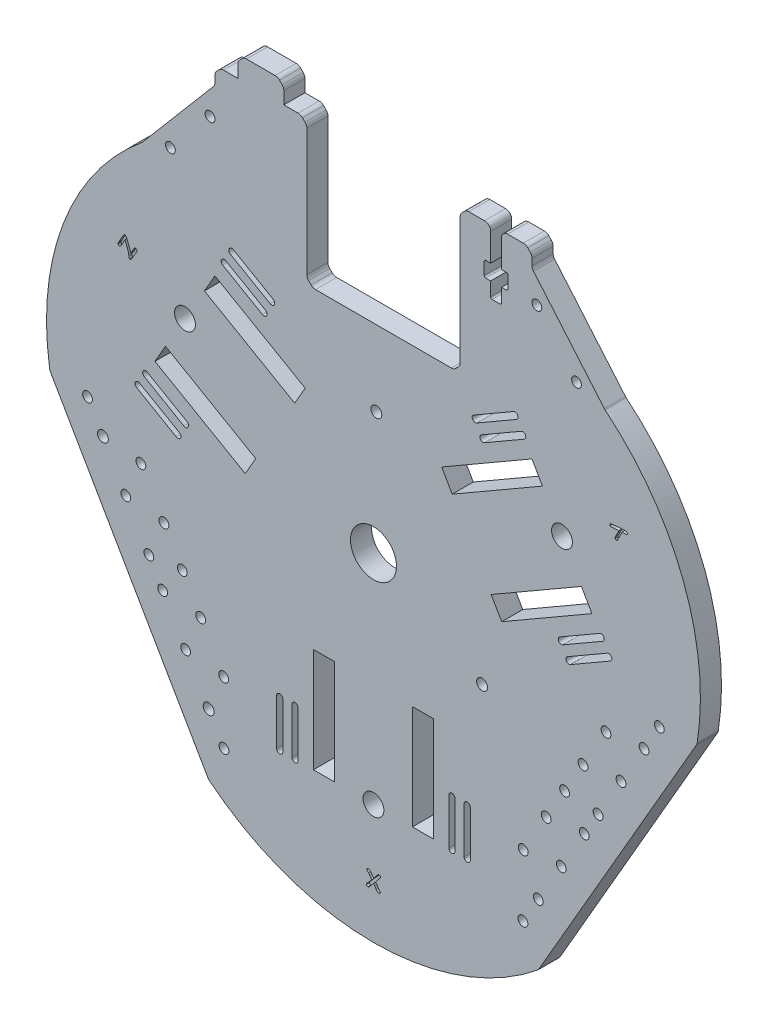
from build123d import *

# Parameters (mm, degrees)
SKETCH1_R           = 110
BOSS_EXTRUDE1_DEPTH = 6.88
SKETCH2_R           = 250
SKETCH2_R_2         = 110
CUT_EXTRUDE1_DEPTH  = 156.715556063
SKETCH4_R           = 3.4
CUT_EXTRUDE2_DEPTH  = 10
CIRPATTERN1_COUNT   = 3
BOSS_EXTRUDE2_DEPTH = 6.88
CHAMFER1_DEPTH      = 6.88
SKETCH7_W           = 50
SKETCH7_H           = 32
CUT_EXTRUDE5_DEPTH  = 155.808566837
SKETCH8_W           = 2.085
SKETCH8_H           = 5
SKETCH8_W_2         = 3.55
SKETCH8_H_2         = 11
CUT_EXTRUDE6_DEPTH  = 6.88
SKETCH9_W           = 15
SKETCH9_H           = 13.76
BOSS_EXTRUDE3_DEPTH = 6.88
CUT_EXTRUDE7_DEPTH  = 6.88
CIRPATTERN2_COUNT   = 3
SKETCH11_R          = 1.775
CUT_EXTRUDE8_DEPTH  = 10
CHAMFER2_SIZE       = 2
SKETCH13_R          = 7.5
CUT_EXTRUDE10_DEPTH = 10
SKETCH15_R          = 1.6
CUT_EXTRUDE11_DEPTH = 10
SKETCH17_R          = 1.6
CUT_EXTRUDE13_DEPTH = 160.856644423
FILLET1_R           = 2
FILLET2_R           = 0.5
CUT_EXTRUDE15_DEPTH = 1


with BuildPart() as part:
    # Sketch1 → Boss-Extrude1 (new body)
    with BuildSketch(Plane.XY):
        Circle(SKETCH1_R)
    extrude(amount=BOSS_EXTRUDE1_DEPTH)

    # Sketch2 → Cut-Extrude1 (cut, through all)
    # profile 1 of 4: a face of its own
    with BuildSketch(Plane.XY.offset(6.88)):
        Circle(SKETCH2_R)
        Circle(SKETCH2_R_2, mode=Mode.SUBTRACT)
    # profile 2 of 4: a face of its own
    with BuildSketch(Plane.XY.offset(6.88)):
        with BuildLine():
            ThreePointArc((95.262813375, 54.999967162), (6.87e-07, 110), (-95.262812689, 54.999968351))
            ThreePointArc((-95.262812689, 54.999968351), (-76.69805922, 77.267129759), (-51.72969758, 92))
            Line((-51.72969758, 92), (51.72969758, 92))
            ThreePointArc((51.72969758, 92), (76.698059743, 77.267129314), (95.262813375, 54.999967162))
        make_face()
    # profile 3 of 4: a face of its own
    with BuildSketch(Plane.XY.offset(6.88)):
        with BuildLine():
            Line((-53.809488358, -90.799232234), (-105.539185938, -1.200767766))
            ThreePointArc((-105.539185938, -1.200767766), (-105.264333432, 27.788866877), (-95.262812689, 54.999968351))
            ThreePointArc((-95.262812689, 54.999968351), (-95.262785273, -55.000015837), (2.9e-08, -110))
            ThreePointArc((2.9e-08, -110), (-28.566284835, -105.056026449), (-53.809488358, -90.799232234))
        make_face()
    # profile 4 of 4: a face of its own
    with BuildSketch(Plane.XY.offset(6.88)):
        with BuildLine():
            ThreePointArc((53.809488358, -90.799232234), (28.566284862, -105.056026439), (2.9e-08, -110))
            ThreePointArc((2.9e-08, -110), (77.781745941, -77.78174592), (110, 0))
            ThreePointArc((110, 0), (106.251845799, 28.470076648), (95.262813375, 54.999967162))
            ThreePointArc((95.262813375, 54.999967162), (105.264333555, 27.788866202), (105.539185938, -1.200767766))
            Line((105.539185938, -1.200767766), (53.809488358, -90.799232234))
        make_face()
    extrude(amount=-CUT_EXTRUDE1_DEPTH, mode=Mode.SUBTRACT)

    # Sketch4 → Cut-Extrude2 (cut)
    with BuildSketch(Plane(origin=(0, 0, 0), x_dir=(-1, 0, 0), z_dir=(0, 0, -1))):
        with Locations((61.487803669, 35.5)):
            Circle(SKETCH4_R)
        Polygon((41.83293994, 1.543222594), (38.39293994, 7.501477372), (67.837803669, 24.501477372), (71.277803669, 18.543222594), align=None)
        Polygon((25.692939941, 29.498522627), (22.252939941, 35.456777405), (51.697803669, 52.456777405), (55.137803669, 46.498522627), align=None)
    cut_extrude2 = extrude(amount=-CUT_EXTRUDE2_DEPTH, mode=Mode.SUBTRACT)

    # CirPattern1: Cut-Extrude2 ×3 about axis
    cirpattern1_axis = Axis((0, 0, 0), (0, 0, 1))
    for i in range(1, CIRPATTERN1_COUNT):
        add(cut_extrude2.rotate(cirpattern1_axis, i * 360 / CIRPATTERN1_COUNT), mode=Mode.SUBTRACT)

    # Sketch6 → Boss-Extrude2 (add)
    with BuildSketch(Plane.XY.offset(6.88)):
        Polygon((-21.72969758, 112), (-21.72969758, 97), (28.27030242, 97), (28.27030242, 112), (51.72969758, 112), (51.72969758, 92), (-51.72969758, 92), (-51.72969758, 112), align=None)
    extrude(amount=-BOSS_EXTRUDE2_DEPTH)

    # Chamfer1: read off the stored shape, not the designer's step
    # Chamfer1 outline → Chamfer1 (add)
    with BuildSketch(Plane.XY):
        with BuildLine():
            Line((-51.72969758, 106.285493371), (-75.437135438, 78.318024741))
            ThreePointArc((-75.437135438, 78.318024741), (-64.13777749, 86.119581166), (-51.72969758, 92))
            Line((-51.72969758, 92), (-51.72969758, 106.285493371))
        make_face()
        with BuildLine():
            Line((75.437135438, 78.318024741), (51.72969758, 106.285493371))
            Line((51.72969758, 106.285493371), (51.72969758, 92))
            ThreePointArc((51.72969758, 92), (64.13777749, 86.119581166), (75.437135438, 78.318024741))
        make_face()
    extrude(amount=CHAMFER1_DEPTH)

    # Sketch7 → Cut-Extrude5 (cut, through all)
    with BuildSketch(Plane.XY.offset(6.88)):
        with Locations((3.27030242, 81)):
            Rectangle(SKETCH7_W, SKETCH7_H)
    extrude(amount=-CUT_EXTRUDE5_DEPTH, mode=Mode.SUBTRACT)

    # Sketch8 → Cut-Extrude6 (cut)
    with BuildSketch(Plane.XY.offset(6.88)):
        with Locations((42.8175, 98.5)):
            Rectangle(SKETCH8_W, SKETCH8_H)
        with Locations((40, 93.5)):
            Rectangle(SKETCH8_W_2, SKETCH8_H)
        with Locations((40, 98.5)):
            Rectangle(SKETCH8_W_2, SKETCH8_H)
        with Locations((37.1825, 98.5)):
            Rectangle(SKETCH8_W, SKETCH8_H)
        with Locations((40, 106.5)):
            Rectangle(SKETCH8_W_2, SKETCH8_H_2)
    extrude(amount=-CUT_EXTRUDE6_DEPTH, mode=Mode.SUBTRACT)

    # Sketch9 → Boss-Extrude3 (add)
    with BuildSketch(Plane.XY.offset(6.88)):
        with Locations((-36.72969758, 112)):
            Rectangle(SKETCH9_W, SKETCH9_H)
    extrude(amount=-BOSS_EXTRUDE3_DEPTH)

    # Sketch10 → Cut-Extrude7 (cut)
    with BuildSketch(Plane.XY.offset(6.88)):
        with BuildLine():
            Line((24.58, -71), (24.58, -56))
            ThreePointArc((24.58, -56), (25.58, -55), (26.58, -56))
            Line((26.58, -56), (26.58, -71))
            ThreePointArc((26.58, -71), (25.58, -72), (24.58, -71))
        make_face()
        with BuildLine():
            Line((31.58, -71), (31.58, -56))
            ThreePointArc((31.58, -56), (30.58, -55), (29.58, -56))
            Line((29.58, -56), (29.58, -71))
            ThreePointArc((29.58, -71), (30.58, -72), (31.58, -71))
        make_face()
        with BuildLine():
            Line((-24.58, -71), (-24.58, -56))
            ThreePointArc((-24.58, -56), (-25.58, -55), (-26.58, -56))
            Line((-26.58, -56), (-26.58, -71))
            ThreePointArc((-26.58, -71), (-25.58, -72), (-24.58, -71))
        make_face()
        with BuildLine():
            Line((-31.58, -71), (-31.58, -56))
            ThreePointArc((-31.58, -56), (-30.58, -55), (-29.58, -56))
            Line((-29.58, -56), (-29.58, -71))
            ThreePointArc((-29.58, -71), (-30.58, -72), (-31.58, -71))
        make_face()
    cut_extrude7 = extrude(amount=-CUT_EXTRUDE7_DEPTH, mode=Mode.SUBTRACT)

    # CirPattern2: Cut-Extrude7 ×3 about axis
    cirpattern2_axis = Axis((0, 0, 0), (0, 0, 1))
    for i in range(1, CIRPATTERN2_COUNT):
        add(cut_extrude7.rotate(cirpattern2_axis, i * 360 / CIRPATTERN2_COUNT), mode=Mode.SUBTRACT)

    # Sketch11 → Cut-Extrude8 (cut)
    with BuildSketch(Plane(origin=(0, 0, 0), x_dir=(-1, 0, 0), z_dir=(0, 0, -1))):
        with Locations((-0.936533479, 40.377876431)):
            Circle(SKETCH11_R)
        with Locations((-35.436533479, -19.377876431)):
            Circle(SKETCH11_R)
        with Locations((88.26408311, -11.122123569)):
            Circle(SKETCH11_R)
        with Locations((53.76408311, -70.877876431)):
            Circle(SKETCH11_R)
    extrude(amount=-CUT_EXTRUDE8_DEPTH, mode=Mode.SUBTRACT)

    # Chamfer2
    chamfer2_edges = [part.edges().sort_by_distance(p)[0] for p in [
        (51.72969758, 112, 3.44),
        (-51.72969758, 112, 3.44),
        (-21.72969758, 112, 3.44),
        (28.27030242, 112, 3.44),
        (-21.72969758, 65, 3.44),
        (28.27030242, 65, 3.44),
        (-44.22969758, 118.88, 3.44),
        (-29.22969758, 118.88, 3.44),
    ]]
    chamfer(chamfer2_edges, length=CHAMFER2_SIZE)

    # Sketch13 → Cut-Extrude10 (cut)
    with BuildSketch(Plane(origin=(0, 0, 0), x_dir=(-1, 0, 0), z_dir=(0, 0, -1))):
        Circle(SKETCH13_R)
    extrude(amount=-CUT_EXTRUDE10_DEPTH, mode=Mode.SUBTRACT)

    # Sketch15 → Cut-Extrude11 (cut)
    with BuildSketch(Plane(origin=(0, 0, 0), x_dir=(-1, 0, 0), z_dir=(0, 0, -1))):
        with Locations((53.76408311, -70.877876431)):
            Circle(SKETCH15_R)
        with Locations(Location((48.853829073, -59.382685902, 0), (0, 0, 180))):
            Circle(SKETCH15_R)
        with Locations(Location((61.26408311, -57.887495374, 0), (0, 0, 180))):
            Circle(SKETCH15_R)
        with Locations(Location((56.353829073, -46.392304845, 0), (0, 0, 180))):
            Circle(SKETCH15_R)
        with Locations(Location((68.76408311, -44.897114317, 0), (0, 0, 180))):
            Circle(SKETCH15_R)
        with Locations((62.353829073, -36)):
            Circle(SKETCH15_R)
        with Locations((73.26408311, -37.102885683)):
            Circle(SKETCH15_R)
        with Locations((68.353829073, -25.607695155)):
            Circle(SKETCH15_R)
        with Locations((80.76408311, -24.112504626)):
            Circle(SKETCH15_R)
        with Locations((75.853829073, -12.617314098)):
            Circle(SKETCH15_R)
        with Locations((88.26408311, -11.122123569)):
            Circle(SKETCH15_R)
        with Locations(Location((-88.26408311, -11.122123569, 0), (0, 0, 180))):
            Circle(SKETCH15_R)
        with Locations(Location((-75.853829072, -12.617314098, 0), (0, 0, 180))):
            Circle(SKETCH15_R)
        with Locations(Location((-80.76408311, -24.112504626, 0), (0, 0, 180))):
            Circle(SKETCH15_R)
        with Locations(Location((-68.353829072, -25.607695155, 0), (0, 0, 180))):
            Circle(SKETCH15_R)
        with Locations(Location((-73.26408311, -37.102885683, 0), (0, 0, 180))):
            Circle(SKETCH15_R)
        with Locations((-62.353829072, -36)):
            Circle(SKETCH15_R)
        with Locations((-68.76408311, -44.897114317)):
            Circle(SKETCH15_R)
        with Locations((-56.353829072, -46.392304845)):
            Circle(SKETCH15_R)
        with Locations((-61.26408311, -57.887495374)):
            Circle(SKETCH15_R)
        with Locations((-48.853829072, -59.382685902)):
            Circle(SKETCH15_R)
        with Locations((-53.76408311, -70.877876431)):
            Circle(SKETCH15_R)
        with Locations((93.26408311, -2.461869532)):
            Circle(SKETCH15_R)
        with Locations(Location((48.76408311, -79.538130468, 0), (0, 0, 180))):
            Circle(SKETCH15_R)
        with Locations((-48.76408311, -79.538130468)):
            Circle(SKETCH15_R)
        with Locations(Location((-93.26408311, -2.461869532, 0), (0, 0, 180))):
            Circle(SKETCH15_R)
    extrude(amount=-CUT_EXTRUDE11_DEPTH, mode=Mode.SUBTRACT)

    # Sketch17 → Cut-Extrude13 (cut, through all)
    with BuildSketch(Plane(origin=(0, 0, 0), x_dir=(-1, 0, 0), z_dir=(0, 0, -1))):
        with Locations((-53.303155084, 96.696781814)):
            Circle(SKETCH17_R)
        with Locations((-66.235555158, 81.440536262)):
            Circle(SKETCH17_R)
        with Locations(Location((66.235555158, 81.440536262, 0), (0, 0, 180))):
            Circle(SKETCH17_R)
        with Locations(Location((53.303155084, 96.696781814, 0), (0, 0, 180))):
            Circle(SKETCH17_R)
    extrude(amount=-CUT_EXTRUDE13_DEPTH, mode=Mode.SUBTRACT)

    # Fillet1
    fillet1_edges = [part.edges().sort_by_distance(p)[0] for p in [
        (-53.809488358, -90.799232234, 3.44),
        (-51.72969758, 106.285493371, 3.44),
        (105.539185938, -1.200767766, 3.44),
        (-75.437135438, 78.318024741, 3.44),
        (75.437135438, 78.318024741, 3.44),
        (51.72969758, 106.285493371, 3.44),
        (-105.539185938, -1.200767766, 3.44),
        (53.809488358, -90.799232234, 3.44),
        (38.225, 112, 3.44),
        (41.775, 112, 3.44),
        (28.27030242, 110, 3.44),
        (28.27030242, 67, 3.44),
        (-19.72969758, 65, 3.44),
        (26.27030242, 65, 3.44),
        (-21.72969758, 110, 3.44),
        (-21.72969758, 67, 3.44),
        (30.27030242, 112, 3.44),
        (51.72969758, 110, 3.44),
        (49.72969758, 112, 3.44),
        (-49.72969758, 112, 3.44),
        (-51.72969758, 110, 3.44),
        (-31.22969758, 118.88, 3.44),
        (-42.22969758, 118.88, 3.44),
        (-44.22969758, 116.88, 3.44),
        (-29.22969758, 116.88, 3.44),
        (-23.72969758, 112, 3.44),
    ]]
    fillet(fillet1_edges, radius=FILLET1_R)

    # Fillet2
    fillet2_edges = [part.edges().sort_by_distance(p)[0] for p in [
        (43.86, 101, 3.44),
        (43.86, 96, 3.44),
        (41.775, 91, 3.44),
        (38.225, 91, 3.44),
        (36.14, 96, 3.44),
        (36.14, 101, 3.44),
    ]]
    fillet(fillet2_edges, radius=FILLET2_R)

    # Sketch21 → Cut-Extrude15 (cut)
    with BuildSketch(Plane.XY.offset(6.88)):
        with BuildLine():
            Line((-78.172380141, 46.871259788), (-78.815120608, 45.758438686))
            add(Edge.make_bspline(
                [(-78.815120608, 45.758438686), (-78.826222016, 45.738366163), (-78.849627909, 45.696045829), (-78.885175765, 45.628558897), (-78.923762732, 45.554030683), (-78.963796498, 45.471950296), (-79.006029658, 45.383005936), (-79.050123436, 45.286736948), (-79.096880353, 45.183510188), (-79.128272557, 45.111817033), (-79.144418942, 45.074942106)],
                knots=[0, 0, 0, 0, 0.090662034, 0.191149243, 0.301479501, 0.422369635, 0.55208769, 0.69065395, 0.840889791, 1, 1, 1, 1], degree=3))
            add(Edge.make_bspline(
                [(-79.144418942, 45.074942106), (-79.157646283, 45.135859664), (-79.184630859, 45.260135174), (-79.233014572, 45.449317861), (-79.287291739, 45.645517666), (-79.348853302, 45.848406891), (-79.417605845, 46.057963776), (-79.492594816, 46.274520133), (-79.574703295, 46.498137683), (-79.633811512, 46.648526992), (-79.663917512, 46.725125827)],
                knots=[0, 0, 0, 0, 0.107961987, 0.220248994, 0.338157253, 0.460533199, 0.587439473, 0.720130635, 0.857452185, 1, 1, 1, 1], degree=3))
            add(Edge.make_bspline(
                [(-79.663917512, 46.725125827), (-79.772657809, 46.990481579), (-79.990211088, 47.521370457), (-80.210533034, 48.051116312), (-80.320730813, 48.316077736)],
                knots=[0, 0, 0, 0, 0.499832946, 1, 1, 1, 1], degree=3))
            add(Edge.make_bspline(
                [(-80.320730813, 48.316077736), (-80.334829903, 48.351376371), (-80.361577662, 48.418342352), (-80.399249681, 48.513759474), (-80.435148144, 48.597568221), (-80.465198729, 48.671792612), (-80.491855257, 48.73512368), (-80.514442847, 48.787789352), (-80.532853003, 48.829854743), (-80.544398323, 48.854053167), (-80.549399788, 48.864535994)],
                knots=[0, 0, 0, 0, 0.191878469, 0.364017752, 0.517812638, 0.652086183, 0.768237333, 0.864662651, 0.941371473, 1, 1, 1, 1], degree=3))
            add(Edge.make_bspline(
                [(-80.549399788, 48.864535994), (-80.576874704, 48.915164438), (-80.628557089, 49.010400351), (-80.716883451, 49.135511803), (-80.80859067, 49.235800434), (-80.878705626, 49.282729091), (-80.911576162, 49.304729677)],
                knots=[0, 0, 0, 0, 0.299162416, 0.56274702, 0.795011788, 1, 1, 1, 1], degree=3))
            add(Edge.make_bspline(
                [(-80.911576162, 49.304729677), (-80.940203978, 49.319356388), (-80.995702436, 49.347712023), (-81.085842196, 49.366145626), (-81.176136195, 49.361237886), (-81.231908647, 49.340895771), (-81.260541846, 49.330452268)],
                knots=[0, 0, 0, 0, 0.264295607, 0.512368758, 0.749653428, 1, 1, 1, 1], degree=3))
            add(Edge.make_bspline(
                [(-81.260541846, 49.330452268), (-81.286361334, 49.317899798), (-81.338546415, 49.292529364), (-81.408291274, 49.236199345), (-81.471252548, 49.166220652), (-81.505428911, 49.111428241), (-81.523112493, 49.083077475)],
                knots=[0, 0, 0, 0, 0.234031378, 0.473012719, 0.727325507, 1, 1, 1, 1], degree=3))
            add(Edge.make_bspline(
                [(-81.523112493, 49.083077475), (-81.544735939, 49.045324041), (-81.59055928, 48.965318824), (-81.663702501, 48.838687871), (-81.743019335, 48.69799365), (-81.831739939, 48.544703032), (-81.925046204, 48.376772302), (-82.027868085, 48.196301048), (-82.136729358, 48.001700119), (-82.25145811, 47.79831817), (-82.36621402, 47.594951702), (-82.475136105, 47.400066388), (-82.57826239, 47.219637639), (-82.673162956, 47.052291345), (-82.76037368, 46.898143502), (-82.840124334, 46.757509053), (-82.913187638, 46.630832668), (-82.959020383, 46.550832798), (-82.980648268, 46.513081886)],
                knots=[0, 0, 0, 0, 0.044176665, 0.093617008, 0.148485422, 0.208170858, 0.273450538, 0.343546322, 0.419071457, 0.499859762, 0.580648066, 0.656173202, 0.72655044, 0.791664212, 0.851514578, 0.906382992, 0.955823335, 1, 1, 1, 1], degree=3))
            add(Edge.make_bspline(
                [(-82.980648268, 46.513081886), (-82.989562069, 46.497780502), (-83.009263251, 46.463961555), (-83.044452616, 46.40978287), (-83.084306585, 46.344982943), (-83.130708243, 46.274808588), (-83.177120656, 46.204835678), (-83.218665799, 46.140758423), (-83.252398429, 46.085667234), (-83.272333754, 46.051815985), (-83.281318728, 46.036559018)],
                knots=[0, 0, 0, 0, 0.094259128, 0.208330453, 0.343845134, 0.499228138, 0.656140107, 0.79086347, 0.905740872, 1, 1, 1, 1], degree=3))
            add(Edge.make_bspline(
                [(-83.281318728, 46.036559018), (-83.295181641, 46.009117095), (-83.322396589, 45.955244541), (-83.345760419, 45.868601789), (-83.350860398, 45.779648873), (-83.341185073, 45.721528809), (-83.336251012, 45.69188971)],
                knots=[0, 0, 0, 0, 0.257820791, 0.506140357, 0.748149716, 1, 1, 1, 1], degree=3))
            add(Edge.make_bspline(
                [(-83.336251012, 45.69188971), (-83.326574082, 45.658003376), (-83.307391013, 45.590828782), (-83.248026293, 45.501351571), (-83.16802596, 45.423724831), (-83.102363486, 45.384763263), (-83.06813006, 45.364450474)],
                knots=[0, 0, 0, 0, 0.240754513, 0.477259843, 0.727467066, 1, 1, 1, 1], degree=3))
            add(Edge.make_bspline(
                [(-83.06813006, 45.364450474), (-83.043630434, 45.352634852), (-82.99613918, 45.329730879), (-82.920850881, 45.311397876), (-82.846781166, 45.306170907), (-82.773180219, 45.315774028), (-82.700287512, 45.339050581), (-82.628337541, 45.376618743), (-82.557660553, 45.428011609), (-82.513974544, 45.469723041), (-82.49110572, 45.49155821)],
                knots=[0, 0, 0, 0, 0.127142861, 0.246459849, 0.3605166, 0.473262713, 0.592046012, 0.71721936, 0.851969522, 1, 1, 1, 1], degree=3))
            add(Edge.make_bspline(
                [(-82.49110572, 45.49155821), (-82.480572292, 45.503011224), (-82.4574251, 45.528179204), (-82.422801949, 45.572150501), (-82.38416178, 45.624369581), (-82.34254247, 45.685332707), (-82.297801365, 45.755216588), (-82.248958968, 45.833235382), (-82.195641282, 45.919398129), (-82.160746659, 45.980538586), (-82.142540123, 46.012439085)],
                knots=[0, 0, 0, 0, 0.074324925, 0.163328908, 0.267209489, 0.384702411, 0.515924197, 0.663666423, 0.824515393, 1, 1, 1, 1], degree=3))
            add(Edge.make_bspline(
                [(-82.142540123, 46.012439085), (-82.124385403, 46.044044993), (-82.086704011, 46.109645265), (-82.028674244, 46.212138565), (-81.967953914, 46.323293353), (-81.903631996, 46.442905705), (-81.834854618, 46.570643715), (-81.761465263, 46.706118103), (-81.685802437, 46.850268095), (-81.634112981, 46.948956602), (-81.6076277, 46.999523837)],
                knots=[0, 0, 0, 0, 0.097389304, 0.202138304, 0.314694358, 0.435802545, 0.56501468, 0.702330778, 0.847476573, 1, 1, 1, 1], degree=3))
            add(Edge.make_bspline(
                [(-81.6076277, 46.999523837), (-81.574374234, 47.062857918), (-81.5112259, 47.183129346), (-81.42187681, 47.354733829), (-81.340314857, 47.506748758), (-81.269763248, 47.641684925), (-81.208625729, 47.757892588), (-81.156137805, 47.855581432), (-81.112909433, 47.934449402), (-81.087926891, 47.981495108), (-81.077090178, 48.001902191)],
                knots=[0, 0, 0, 0, 0.189219172, 0.359327227, 0.511763811, 0.645541699, 0.762100804, 0.859098755, 0.938881067, 1, 1, 1, 1], degree=3))
            Line((-81.077090178, 48.001902191), (-81.069468724, 47.982914408))
            add(Edge.make_bspline(
                [(-81.069468724, 47.982914408), (-80.948970762, 47.69533609), (-80.708328689, 47.121023949), (-80.46890981, 46.546200809), (-80.349376397, 46.259211861)],
                knots=[0, 0, 0, 0, 0.500735221, 1, 1, 1, 1], degree=3))
            add(Edge.make_bspline(
                [(-80.349376397, 46.259211861), (-80.313286455, 46.16860161), (-80.243282042, 45.992843019), (-80.147986344, 45.73486037), (-80.063655525, 45.491461382), (-79.992171159, 45.261903707), (-79.93320792, 45.046647071), (-79.886582998, 44.845601993), (-79.849682188, 44.659091745), (-79.8351716, 44.538484011), (-79.828230113, 44.480788415)],
                knots=[0, 0, 0, 0, 0.157418586, 0.305348111, 0.443857844, 0.573145767, 0.693349039, 0.803990476, 0.906234152, 1, 1, 1, 1], degree=3))
            add(Edge.make_bspline(
                [(-79.828230113, 44.480788415), (-79.825475521, 44.432119697), (-79.820209363, 44.339076099), (-79.816814739, 44.205222451), (-79.811118672, 44.083950206), (-79.809577577, 44.007007663), (-79.80885152, 43.970757657)],
                knots=[0, 0, 0, 0, 0.286488216, 0.547700768, 0.786907876, 1, 1, 1, 1], degree=3))
            add(Edge.make_bspline(
                [(-79.80885152, 43.970757657), (-79.805341964, 43.930325512), (-79.798620099, 43.852885689), (-79.781153758, 43.742936907), (-79.757140162, 43.644993518), (-79.728441468, 43.55845707), (-79.692463371, 43.484071241), (-79.651069087, 43.421408578), (-79.604249938, 43.369227012), (-79.566790851, 43.344641017), (-79.548439159, 43.33259602)],
                knots=[0, 0, 0, 0, 0.170363389, 0.326297563, 0.46684298, 0.59338275, 0.708404569, 0.812561082, 0.908171246, 1, 1, 1, 1], degree=3))
            add(Edge.make_bspline(
                [(-79.548439159, 43.33259602), (-79.533814548, 43.32511674), (-79.505001299, 43.310381145), (-79.458966751, 43.296301387), (-79.411757032, 43.292125159), (-79.363887567, 43.294702083), (-79.315198589, 43.306552994), (-79.265415019, 43.325174373), (-79.214398539, 43.352333434), (-79.164105646, 43.389469824), (-79.110465702, 43.43188493), (-79.058046658, 43.484257737), (-79.003490023, 43.543746979), (-78.948131813, 43.611424811), (-78.892146697, 43.687619221), (-78.834247559, 43.771086751), (-78.775808533, 43.862848834), (-78.737999859, 43.927579364), (-78.718468859, 43.961017513)],
                knots=[0, 0, 0, 0, 0.043058526, 0.084833436, 0.125336768, 0.166838189, 0.210069923, 0.25625468, 0.306057815, 0.361127305, 0.420073283, 0.485344791, 0.555249622, 0.631872056, 0.714621559, 0.803303753, 0.898391714, 1, 1, 1, 1], degree=3))
            add(Edge.make_bspline(
                [(-78.718468859, 43.961017513), (-78.707506503, 43.979968076), (-78.684283896, 44.020112866), (-78.647515572, 44.083702623), (-78.606765769, 44.153651593), (-78.562979471, 44.230825264), (-78.51438442, 44.314202802), (-78.461927294, 44.404328908), (-78.406430061, 44.501679131), (-78.347278209, 44.60258335), (-78.289244073, 44.704455004), (-78.23270259, 44.800880548), (-78.181202163, 44.89155899), (-78.132518213, 44.974563745), (-78.088785799, 45.051768522), (-78.04802335, 45.121710191), (-78.011257895, 45.185301605), (-77.98803495, 45.225446199), (-77.977072435, 45.24439667)],
                knots=[0, 0, 0, 0, 0.044313304, 0.093873109, 0.148679419, 0.208168984, 0.273468318, 0.34401417, 0.419242915, 0.500281805, 0.580756981, 0.65654935, 0.726531682, 0.791831016, 0.851320581, 0.906126891, 0.955686696, 1, 1, 1, 1], degree=3))
            add(Edge.make_bspline(
                [(-77.977072435, 45.24439667), (-77.956008531, 45.280270544), (-77.909313199, 45.359797228), (-77.825813976, 45.486707005), (-77.727594604, 45.63688715), (-77.615097658, 45.799841722), (-77.502086904, 45.962630433), (-77.404626227, 46.114002951), (-77.321135287, 46.241600909), (-77.27418244, 46.321477119), (-77.253101398, 46.3573402)],
                knots=[0, 0, 0, 0, 0.093963263, 0.208301636, 0.343095276, 0.499347584, 0.655599892, 0.790719898, 0.906036737, 1, 1, 1, 1], degree=3))
            add(Edge.make_bspline(
                [(-77.253101398, 46.3573402), (-77.228822875, 46.402356995), (-77.183202636, 46.486945207), (-77.13708459, 46.615546654), (-77.115887567, 46.735486509), (-77.119667469, 46.847329667), (-77.150122529, 46.950160432), (-77.206826775, 47.042749247), (-77.288027101, 47.125592174), (-77.355683285, 47.168325323), (-77.39128058, 47.190809366)],
                knots=[0, 0, 0, 0, 0.158789931, 0.298372122, 0.422590565, 0.535204912, 0.643046542, 0.751970414, 0.869499254, 1, 1, 1, 1], degree=3))
            add(Edge.make_bspline(
                [(-77.39128058, 47.190809366), (-77.426587535, 47.209372463), (-77.494386534, 47.24501868), (-77.602129487, 47.274030495), (-77.708170687, 47.283422246), (-77.775890493, 47.270027109), (-77.809602905, 47.263358714)],
                knots=[0, 0, 0, 0, 0.274119847, 0.526384998, 0.764224009, 1, 1, 1, 1], degree=3))
            add(Edge.make_bspline(
                [(-77.809602905, 47.263358714), (-77.83848574, 47.254536128), (-77.895160017, 47.237224334), (-77.970215374, 47.190322891), (-78.036142342, 47.130611809), (-78.068011179, 47.080424732), (-78.084428347, 47.05457096)],
                knots=[0, 0, 0, 0, 0.254442313, 0.499270032, 0.742049963, 1, 1, 1, 1], degree=3))
            add(Edge.make_bspline(
                [(-78.084428347, 47.05457096), (-78.091015366, 47.0420093), (-78.106804596, 47.011898721), (-78.127816885, 46.962543787), (-78.150301454, 46.913863858), (-78.165855505, 46.883850032), (-78.172380141, 46.871259788)],
                knots=[0, 0, 0, 0, 0.20916486, 0.501372806, 0.79083514, 1, 1, 1, 1], degree=3))
        make_face()
        with BuildLine():
            Line((79.061358178, 44.404303313), (78.848099773, 43.990498692))
            add(Edge.make_bspline(
                [(78.848099773, 43.990498692), (78.834173047, 43.948527591), (78.807880693, 43.869290079), (78.795203079, 43.749407344), (78.809435492, 43.637336816), (78.840959403, 43.57215018), (78.856566458, 43.539877174)],
                knots=[0, 0, 0, 0, 0.284067558, 0.53629296, 0.770425029, 1, 1, 1, 1], degree=3))
            add(Edge.make_bspline(
                [(78.856566458, 43.539877174), (78.872745706, 43.514903227), (78.904691031, 43.465593096), (78.966801334, 43.403431083), (79.039618852, 43.353780083), (79.09417266, 43.332200331), (79.122049845, 43.321173003)],
                knots=[0, 0, 0, 0, 0.253463268, 0.500453809, 0.74473017, 1, 1, 1, 1], degree=3))
            add(Edge.make_bspline(
                [(79.122049845, 43.321173003), (79.152342971, 43.312562697), (79.211321021, 43.29579919), (79.3027965, 43.294026112), (79.391267268, 43.312834132), (79.444996712, 43.339461609), (79.472314514, 43.352999887)],
                knots=[0, 0, 0, 0, 0.259641861, 0.505499834, 0.748579988, 1, 1, 1, 1], degree=3))
            add(Edge.make_bspline(
                [(79.472314514, 43.352999887), (79.489321244, 43.363558172), (79.523133042, 43.384549543), (79.567472197, 43.425793571), (79.607135831, 43.472768086), (79.628639919, 43.508378322), (79.639507894, 43.52637542)],
                knots=[0, 0, 0, 0, 0.245834451, 0.48875383, 0.741620716, 1, 1, 1, 1], degree=3))
            add(Edge.make_bspline(
                [(79.639507894, 43.52637542), (79.687465795, 43.619445116), (79.780196254, 43.79940286), (79.915439262, 44.06028389), (80.040717139, 44.303421529), (80.155012311, 44.52963134), (80.262175777, 44.736645838), (80.357947006, 44.926943461), (80.444554406, 45.099280929), (80.498610527, 45.208434797), (80.524134639, 45.259974854)],
                knots=[0, 0, 0, 0, 0.161382873, 0.312046767, 0.452944208, 0.582975186, 0.702702395, 0.812249627, 0.911348401, 1, 1, 1, 1], degree=3))
            add(Edge.make_bspline(
                [(80.524134639, 45.259974854), (80.556240395, 45.323379842), (80.618437014, 45.446210648), (80.707737892, 45.624480279), (80.790446479, 45.790887571), (80.867289467, 45.944778971), (80.936462796, 46.087541576), (80.999194777, 46.218273224), (81.054893997, 46.337349053), (81.090019459, 46.412687215), (81.106602747, 46.448255558)],
                knots=[0, 0, 0, 0, 0.161103565, 0.312096598, 0.451970918, 0.582344716, 0.702008215, 0.811571636, 0.911039976, 1, 1, 1, 1], degree=3))
            add(Edge.make_bspline(
                [(81.106602747, 46.448255558), (81.162073853, 46.44788784), (81.269823631, 46.447173566), (81.426385232, 46.447719615), (81.57353446, 46.448499782), (81.711137305, 46.450749045), (81.839076602, 46.451769314), (81.957302596, 46.455111335), (82.065812462, 46.459339682), (82.16513142, 46.462645508), (82.254438026, 46.467684385), (82.334337307, 46.473297178), (82.404588942, 46.479375291), (82.46517947, 46.486831355), (82.516394636, 46.493059527), (82.557700707, 46.501556484), (82.589914042, 46.510233336), (82.607238582, 46.518125881), (82.614615249, 46.521486471)],
                knots=[0, 0, 0, 0, 0.109925929, 0.21352548, 0.310250042, 0.40152514, 0.486240886, 0.563782035, 0.635887526, 0.70143503, 0.760699456, 0.813128169, 0.860161851, 0.90040044, 0.934118865, 0.962324687, 0.983958117, 1, 1, 1, 1], degree=3))
            add(Edge.make_bspline(
                [(82.614615249, 46.521486471), (82.640403554, 46.538412729), (82.69129128, 46.571813093), (82.750791104, 46.641385027), (82.795136544, 46.722825464), (82.809810568, 46.783257756), (82.817405069, 46.814534324)],
                knots=[0, 0, 0, 0, 0.250599777, 0.494505294, 0.738382592, 1, 1, 1, 1], degree=3))
            add(Edge.make_bspline(
                [(82.817405069, 46.814534324), (82.821229938, 46.843897559), (82.828781131, 46.901867493), (82.82043608, 46.988976239), (82.798562424, 47.073854572), (82.771842432, 47.125870361), (82.758237533, 47.152355008)],
                knots=[0, 0, 0, 0, 0.253219206, 0.4999143, 0.745373594, 1, 1, 1, 1], degree=3))
            add(Edge.make_bspline(
                [(82.758237533, 47.152355008), (82.746803812, 47.169938766), (82.72391621, 47.205137286), (82.682253787, 47.252698528), (82.632357463, 47.293143303), (82.575983021, 47.326963774), (82.51307983, 47.354927673), (82.444232797, 47.378011104), (82.367795589, 47.39272539), (82.314586997, 47.398493087), (82.286968756, 47.401486845)],
                knots=[0, 0, 0, 0, 0.113198087, 0.226595759, 0.339793845, 0.458694635, 0.580612705, 0.710968431, 0.849976419, 1, 1, 1, 1], degree=3))
            add(Edge.make_bspline(
                [(82.286968756, 47.401486845), (82.282781462, 47.401720284), (82.271981269, 47.402322387), (82.25195391, 47.401489661), (82.224322136, 47.401378002), (82.188913458, 47.400801667), (82.145589947, 47.40089721), (82.094552398, 47.398052984), (82.035537386, 47.398734757), (81.968814243, 47.396025305), (81.894309576, 47.394717144), (81.811801871, 47.391357067), (81.721628864, 47.389412682), (81.623279984, 47.386148071), (81.517275602, 47.384088723), (81.403397912, 47.380666793), (81.28194002, 47.375928763), (81.198390193, 47.373918144), (81.155244034, 47.372879835)],
                knots=[0, 0, 0, 0, 0.011107749, 0.028649968, 0.053060272, 0.084338817, 0.122485677, 0.167838208, 0.219721798, 0.278806377, 0.344757735, 0.4171714, 0.497605076, 0.583750708, 0.677918343, 0.778546574, 0.885638723, 1, 1, 1, 1], degree=3))
            add(Edge.make_bspline(
                [(81.155244034, 47.372879835), (81.101764822, 47.371220893), (80.990653466, 47.367774185), (80.817688905, 47.35727421), (80.631633636, 47.34661584), (80.432596, 47.329675569), (80.220401429, 47.312603131), (79.995214699, 47.290055294), (79.756897839, 47.266471973), (79.593724835, 47.247826238), (79.510046021, 47.238264283)],
                knots=[0, 0, 0, 0, 0.097208708, 0.201966164, 0.314820975, 0.435796689, 0.564885979, 0.701603211, 0.846975366, 1, 1, 1, 1], degree=3))
            add(Edge.make_bspline(
                [(79.510046021, 47.238264283), (79.411600003, 47.227419944), (79.22372881, 47.206724959), (78.955389524, 47.17776177), (78.713701007, 47.15160895), (78.498589625, 47.130264645), (78.310302281, 47.110020071), (78.14884976, 47.094961085), (78.014031322, 47.082881275), (77.933044729, 47.076162069), (77.896925873, 47.073165399)],
                knots=[0, 0, 0, 0, 0.183229473, 0.349669191, 0.499319563, 0.632966993, 0.749583375, 0.849658119, 0.932949684, 1, 1, 1, 1], degree=3))
            add(Edge.make_bspline(
                [(77.896925873, 47.073165399), (77.862779249, 47.070786464), (77.798049882, 47.066276883), (77.706377657, 47.056104345), (77.624921988, 47.047946583), (77.554135853, 47.036392948), (77.493026993, 47.026966916), (77.442898722, 47.01408198), (77.402590838, 47.002273972), (77.380613909, 46.991439689), (77.371043221, 46.986721489)],
                knots=[0, 0, 0, 0, 0.19177336, 0.363531346, 0.516817976, 0.650299504, 0.765426683, 0.862924452, 0.940305246, 1, 1, 1, 1], degree=3))
            add(Edge.make_bspline(
                [(77.371043221, 46.986721489), (77.344767765, 46.969981607), (77.293501699, 46.93732041), (77.23425005, 46.868543287), (77.18957746, 46.78977029), (77.174915676, 46.73110531), (77.167383491, 46.700967403)],
                knots=[0, 0, 0, 0, 0.256847868, 0.5011361, 0.743719111, 1, 1, 1, 1], degree=3))
            add(Edge.make_bspline(
                [(77.167383491, 46.700967403), (77.163303302, 46.672479993), (77.155324614, 46.616773703), (77.158780196, 46.532351029), (77.181250932, 46.451520171), (77.20623481, 46.401658262), (77.218834977, 46.376511309)],
                knots=[0, 0, 0, 0, 0.256863085, 0.502288176, 0.748988037, 1, 1, 1, 1], degree=3))
            add(Edge.make_bspline(
                [(77.218834977, 46.376511309), (77.231418859, 46.356602245), (77.255774199, 46.318069459), (77.300531452, 46.267846371), (77.35082684, 46.227435331), (77.406175446, 46.195661906), (77.467290339, 46.174936292), (77.533294829, 46.162354261), (77.604659736, 46.158762228), (77.653482506, 46.163831873), (77.678684246, 46.166448764)],
                knots=[0, 0, 0, 0, 0.130587857, 0.252744872, 0.371396785, 0.487401855, 0.605096937, 0.72782624, 0.859507105, 1, 1, 1, 1], degree=3))
            add(Edge.make_bspline(
                [(77.678684246, 46.166448764), (77.718471664, 46.170774507), (77.795485036, 46.179147509), (77.9071439, 46.192582853), (78.011111666, 46.204894306), (78.107243595, 46.215901793), (78.195556712, 46.225421769), (78.276261029, 46.234241145), (78.34928045, 46.241870571), (78.395331709, 46.247166971), (78.416930711, 46.249651093)],
                knots=[0, 0, 0, 0, 0.16161036, 0.312816454, 0.454135353, 0.584375449, 0.703539251, 0.812816392, 0.912206979, 1, 1, 1, 1], degree=3))
            add(Edge.make_bspline(
                [(78.416930711, 46.249651093), (78.506774026, 46.257432184), (78.680579061, 46.272484974), (78.932441874, 46.292932426), (79.166776154, 46.312308322), (79.384071479, 46.32995687), (79.584146343, 46.34443542), (79.76677367, 46.356758679), (79.931814934, 46.36909097), (80.036320542, 46.375075869), (80.085844443, 46.377912038)],
                knots=[0, 0, 0, 0, 0.161623137, 0.31266561, 0.452882125, 0.583040208, 0.703390557, 0.812397564, 0.91109755, 1, 1, 1, 1], degree=3))
            add(Edge.make_bspline(
                [(80.085844443, 46.377912038), (80.071721129, 46.343322765), (80.042576486, 46.2719449), (79.995820736, 46.161888694), (79.941702129, 46.046628337), (79.883280785, 45.925002349), (79.819191621, 45.797717327), (79.750259856, 45.664070272), (79.675542834, 45.524535479), (79.623167558, 45.429809007), (79.596434445, 45.381459218)],
                knots=[0, 0, 0, 0, 0.100896508, 0.208208407, 0.322865805, 0.444716745, 0.572583786, 0.707694259, 0.850802837, 1, 1, 1, 1], degree=3))
            add(Edge.make_bspline(
                [(79.596434445, 45.381459218), (79.57574236, 45.343441775), (79.535676532, 45.269829071), (79.47638987, 45.163807713), (79.422484912, 45.063889898), (79.37117045, 44.971728376), (79.325461135, 44.885239851), (79.281223817, 44.807310608), (79.242909375, 44.735379144), (79.206556444, 44.67154958), (79.176256897, 44.61346251), (79.148104808, 44.563055938), (79.124850706, 44.519212411), (79.104151608, 44.48302355), (79.088034709, 44.453381753), (79.075089389, 44.431157467), (79.067933419, 44.414848508), (79.063111103, 44.407114607), (79.061358178, 44.404303313)],
                knots=[0, 0, 0, 0, 0.11655208, 0.225678347, 0.32708674, 0.422257678, 0.509713258, 0.590481468, 0.663531602, 0.729155773, 0.788253935, 0.839922688, 0.884614671, 0.921881182, 0.95216926, 0.975479676, 0.991086794, 1, 1, 1, 1], degree=3))
        make_face()
        with BuildLine():
            ThreePointArc((1.382038706, -93.534963819), (1.040808539, -93.053710555), (0.699431746, -92.57256129))
            add(Edge.make_bspline(
                [(0.699431746, -92.57256129), (0.744053457, -92.516054983), (0.830336949, -92.406790651), (0.954496789, -92.247874171), (1.070545054, -92.100840637), (1.173640189, -91.961408695), (1.271572332, -91.8355498), (1.356773232, -91.717497877), (1.433636723, -91.611130868), (1.481075102, -91.543357639), (1.503428962, -91.511421614)],
                knots=[0, 0, 0, 0, 0.162217039, 0.313673599, 0.454370866, 0.584199229, 0.704329881, 0.813620237, 0.912174334, 1, 1, 1, 1], degree=3))
            add(Edge.make_bspline(
                [(1.503428962, -91.511421614), (1.524432197, -91.482901324), (1.567815176, -91.423991581), (1.636204998, -91.333011314), (1.710177186, -91.236676576), (1.792193377, -91.136198775), (1.879753408, -91.030384189), (1.972439461, -90.91829036), (2.07213839, -90.802032316), (2.141239509, -90.72320196), (2.176625594, -90.682833617)],
                knots=[0, 0, 0, 0, 0.099493625, 0.20550786, 0.319717969, 0.440643391, 0.569809904, 0.705531708, 0.84920534, 1, 1, 1, 1], degree=3))
            add(Edge.make_bspline(
                [(2.176625594, -90.682833617), (2.195333819, -90.660214051), (2.231607224, -90.61635694), (2.268810389, -90.542317238), (2.294732104, -90.467133848), (2.297035618, -90.415612326), (2.298184844, -90.389908192)],
                knots=[0, 0, 0, 0, 0.270791682, 0.525038401, 0.763041221, 1, 1, 1, 1], degree=3))
            add(Edge.make_bspline(
                [(2.298184844, -90.389908192), (2.296697069, -90.360161993), (2.293759821, -90.301435354), (2.264185348, -90.217726464), (2.219758683, -90.139651093), (2.157061921, -90.071318697), (2.083259901, -90.013612708), (2.001308773, -89.970419744), (1.912399231, -89.944896003), (1.85120008, -89.941534389), (1.820039609, -89.939822772)],
                knots=[0, 0, 0, 0, 0.122373858, 0.241597432, 0.36238454, 0.491245057, 0.621634625, 0.747563281, 0.871468035, 1, 1, 1, 1], degree=3))
            add(Edge.make_bspline(
                [(1.820039609, -89.939822772), (1.797909945, -89.942730208), (1.747446955, -89.949360128), (1.669581612, -89.99130882), (1.580123033, -90.054076775), (1.477491991, -90.141000606), (1.363178841, -90.252833763), (1.236487788, -90.388856117), (1.096502545, -90.549135383), (1.001341246, -90.665902036), (0.95082259, -90.727890412)],
                knots=[0, 0, 0, 0, 0.055766944, 0.127167171, 0.218852282, 0.331346868, 0.464739459, 0.62107456, 0.798838349, 1, 1, 1, 1], degree=3))
            add(Edge.make_bspline(
                [(0.95082259, -90.727890412), (0.814338358, -90.910005886), (0.541268061, -91.27437271), (0.267186284, -91.637979295), (0.130094291, -91.819850384)],
                knots=[0, 0, 0, 0, 0.499813544, 1, 1, 1, 1], degree=3))
            add(Edge.make_bspline(
                [(0.130094291, -91.819850384), (0.03434181, -91.697138141), (-0.157535075, -91.451237013), (-0.358293823, -91.212531937), (-0.458867767, -91.092948053)],
                knots=[0, 0, 0, 0, 0.499030827, 1, 1, 1, 1], degree=3))
            add(Edge.make_bspline(
                [(-0.458867767, -91.092948053), (-0.500127831, -91.038056479), (-0.577400509, -90.935254435), (-0.68624979, -90.792233652), (-0.777579534, -90.668948095), (-0.854896407, -90.561477437), (-0.928742555, -90.464029989), (-1.009565349, -90.371900221), (-1.097534373, -90.278085575), (-1.161981578, -90.218688232), (-1.195053027, -90.188208149)],
                knots=[0, 0, 0, 0, 0.176280255, 0.330141211, 0.461386363, 0.570119861, 0.670035566, 0.775085779, 0.884583994, 1, 1, 1, 1], degree=3))
            add(Edge.make_bspline(
                [(-1.195053027, -90.188208149), (-1.218438453, -90.168607514), (-1.263144254, -90.131137079), (-1.329077348, -90.079293094), (-1.393112167, -90.037510994), (-1.451959472, -90.000523418), (-1.50915903, -89.974571373), (-1.561649642, -89.954098574), (-1.611180957, -89.941421701), (-1.643284185, -89.939808561), (-1.658545784, -89.939041688)],
                knots=[0, 0, 0, 0, 0.170917328, 0.326741782, 0.46927592, 0.599046029, 0.715433952, 0.820334949, 0.914588774, 1, 1, 1, 1], degree=3))
            add(Edge.make_bspline(
                [(-1.658545784, -89.939041688), (-1.690586979, -89.940339981), (-1.753071992, -89.942871842), (-1.841664894, -89.971535411), (-1.922742416, -90.015022669), (-1.991364053, -90.077099109), (-2.048419148, -90.148318453), (-2.090921596, -90.22550529), (-2.117721263, -90.30753307), (-2.120421831, -90.36403774), (-2.121781257, -90.392481351)],
                knots=[0, 0, 0, 0, 0.133364037, 0.260079368, 0.384988892, 0.515081457, 0.643500018, 0.764635409, 0.881520965, 1, 1, 1, 1], degree=3))
            add(Edge.make_bspline(
                [(-2.121781257, -90.392481351), (-2.119403447, -90.425387052), (-2.114641682, -90.491283477), (-2.078233516, -90.585874864), (-2.018569647, -90.672897231), (-1.933633499, -90.74906795), (-1.83724679, -90.831443711), (-1.739342625, -90.934775521), (-1.635281054, -91.05448491), (-1.567380764, -91.142564785), (-1.531672294, -91.188885611)],
                knots=[0, 0, 0, 0, 0.097176416, 0.194603921, 0.29572299, 0.406526051, 0.530761395, 0.671034221, 0.826998315, 1, 1, 1, 1], degree=3))
            add(Edge.make_bspline(
                [(-1.531672294, -91.188885611), (-1.505223685, -91.223730162), (-1.455460757, -91.289290012), (-1.3857257, -91.38159399), (-1.325052568, -91.460400333), (-1.276247504, -91.527947037), (-1.233900784, -91.58004665), (-1.202936251, -91.620933654), (-1.181519776, -91.648692631), (-1.170238794, -91.662551621), (-1.166334686, -91.667347923)],
                knots=[0, 0, 0, 0, 0.217994216, 0.410155048, 0.576482498, 0.71360182, 0.825302972, 0.910952693, 0.969182621, 1, 1, 1, 1], degree=3))
            add(Edge.make_bspline(
                [(-1.166334686, -91.667347923), (-1.048819904, -91.80680785), (-0.815946371, -92.083169046), (-0.593979288, -92.368363014), (-0.484023275, -92.509639781)],
                knots=[0, 0, 0, 0, 0.504629191, 1, 1, 1, 1], degree=3))
            add(Edge.make_bspline(
                [(-0.484023275, -92.509639781), (-0.542264399, -92.575261427), (-0.655777562, -92.703159381), (-0.821975336, -92.888830266), (-0.978494581, -93.064336664), (-1.126423136, -93.228705865), (-1.265148757, -93.382357265), (-1.395785128, -93.524405064), (-1.516121891, -93.656453621), (-1.593806729, -93.740699673), (-1.631030323, -93.78106715)],
                knots=[0, 0, 0, 0, 0.153714558, 0.299592871, 0.436565426, 0.565702889, 0.687006567, 0.799234035, 0.903800652, 1, 1, 1, 1], degree=3))
            add(Edge.make_bspline(
                [(-1.631030323, -93.78106715), (-1.662702758, -93.814943992), (-1.723965409, -93.880470535), (-1.812933774, -93.975658067), (-1.896718323, -94.063291874), (-1.972991802, -94.145981906), (-2.044022329, -94.221177525), (-2.108916677, -94.290010888), (-2.168163731, -94.351723136), (-2.205027087, -94.391202757), (-2.222449855, -94.409862051)],
                knots=[0, 0, 0, 0, 0.161173239, 0.311750572, 0.452803158, 0.582513433, 0.702696821, 0.812285402, 0.91128025, 1, 1, 1, 1], degree=3))
            add(Edge.make_bspline(
                [(-2.222449855, -94.409862051), (-2.239790509, -94.431480629), (-2.273461291, -94.473457963), (-2.309589915, -94.544472541), (-2.331718425, -94.619025916), (-2.334427381, -94.670171444), (-2.335785456, -94.695812119)],
                knots=[0, 0, 0, 0, 0.263952177, 0.512522547, 0.755614004, 1, 1, 1, 1], degree=3))
            add(Edge.make_bspline(
                [(-2.335785456, -94.695812119), (-2.334131316, -94.725430761), (-2.330832883, -94.784491742), (-2.297877063, -94.868858048), (-2.244790484, -94.94560954), (-2.173758619, -95.013312663), (-2.090613595, -95.071031249), (-1.997031187, -95.112004085), (-1.896859515, -95.138495692), (-1.827212065, -95.141065227), (-1.791737878, -95.142373993)],
                knots=[0, 0, 0, 0, 0.113792241, 0.226907141, 0.343764593, 0.471312438, 0.603284189, 0.731983622, 0.863488711, 1, 1, 1, 1], degree=3))
            add(Edge.make_bspline(
                [(-1.791737878, -95.142373993), (-1.75644975, -95.140831502), (-1.687412915, -95.137813811), (-1.587013573, -95.111211099), (-1.493174948, -95.067681289), (-1.437736569, -95.026267025), (-1.409760141, -95.005367728)],
                knots=[0, 0, 0, 0, 0.25536248, 0.499584947, 0.747470514, 1, 1, 1, 1], degree=3))
            add(Edge.make_bspline(
                [(-1.409760141, -95.005367728), (-1.379648693, -94.971329266), (-1.321176595, -94.905231474), (-1.237151628, -94.809071218), (-1.15930173, -94.719126419), (-1.086718915, -94.636187761), (-1.020210723, -94.559393556), (-0.960996571, -94.48773649), (-0.906994311, -94.423507098), (-0.873123678, -94.382617603), (-0.85716074, -94.363346734)],
                knots=[0, 0, 0, 0, 0.16093871, 0.3125198, 0.452223114, 0.582202387, 0.702829541, 0.811970064, 0.911383103, 1, 1, 1, 1], degree=3))
            add(Edge.make_bspline(
                [(-0.85716074, -94.363346734), (-0.810934546, -94.309626324), (-0.720401276, -94.204415749), (-0.588286271, -94.049249082), (-0.463509669, -93.899721425), (-0.343008575, -93.758410455), (-0.229697748, -93.622460989), (-0.122525914, -93.493015653), (-0.021619538, -93.369721918), (0.043757311, -93.290044884), (0.075574524, -93.251268143)],
                knots=[0, 0, 0, 0, 0.146479209, 0.286877218, 0.421198128, 0.548991348, 0.670709348, 0.786980091, 0.896328749, 1, 1, 1, 1], degree=3))
            add(Edge.make_bspline(
                [(0.075574524, -93.251268143), (0.114192662, -93.310267903), (0.186487071, -93.420717371), (0.286111914, -93.575234394), (0.372107969, -93.705176544), (0.422712656, -93.784779676), (0.445504057, -93.820631433)],
                knots=[0, 0, 0, 0, 0.311556031, 0.58324302, 0.812300475, 1, 1, 1, 1], degree=3))
            add(Edge.make_bspline(
                [(0.445504057, -93.820631433), (0.466596625, -93.855229744), (0.507276034, -93.921956511), (0.566328241, -94.018914877), (0.622308484, -94.108327798), (0.671206864, -94.193366231), (0.718627567, -94.26990671), (0.760158949, -94.340980392), (0.798524836, -94.40457861), (0.821850123, -94.445316406), (0.832873227, -94.464568344)],
                knots=[0, 0, 0, 0, 0.161759759, 0.311972047, 0.453203368, 0.582837553, 0.703508582, 0.812608861, 0.911442373, 1, 1, 1, 1], degree=3))
            add(Edge.make_bspline(
                [(0.832873227, -94.464568344), (0.870571189, -94.523794618), (0.942152439, -94.636254029), (1.054507084, -94.789131351), (1.164430129, -94.918069884), (1.270483662, -95.025460938), (1.375874118, -95.107722736), (1.477576791, -95.168814435), (1.578157306, -95.206721363), (1.645517413, -95.211739801), (1.67771254, -95.21413839)],
                knots=[0, 0, 0, 0, 0.179941534, 0.341674694, 0.485864789, 0.614025551, 0.727892626, 0.827562955, 0.917582782, 1, 1, 1, 1], degree=3))
            add(Edge.make_bspline(
                [(1.67771254, -95.21413839), (1.713677711, -95.212429187), (1.784146058, -95.209080261), (1.886356688, -95.184292818), (1.980052264, -95.140658847), (2.065017205, -95.083733858), (2.134759705, -95.01328716), (2.188652441, -94.936129904), (2.220079733, -94.850474168), (2.224109271, -94.791318406), (2.226131202, -94.761635401)],
                knots=[0, 0, 0, 0, 0.137223498, 0.26886882, 0.398299325, 0.529967522, 0.657073582, 0.774518539, 0.886858575, 1, 1, 1, 1], degree=3))
            add(Edge.make_bspline(
                [(2.226131202, -94.761635401), (2.224909491, -94.735354801), (2.222472258, -94.682926687), (2.196789055, -94.606866162), (2.160678527, -94.531756027), (2.124598122, -94.487556522), (2.105893131, -94.464642386)],
                knots=[0, 0, 0, 0, 0.240035428, 0.478855295, 0.729825457, 1, 1, 1, 1], degree=3))
            add(Edge.make_bspline(
                [(2.105893131, -94.464642386), (2.049991651, -94.399759759), (1.932738408, -94.263668577), (1.757342861, -94.042741835), (1.571340344, -93.798134496), (1.446789061, -93.624980973), (1.382038706, -93.534963819)],
                knots=[0, 0, 0, 0, 0.217953854, 0.457157775, 0.717793139, 1, 1, 1, 1], degree=3))
        make_face()
    extrude(amount=-CUT_EXTRUDE15_DEPTH, mode=Mode.SUBTRACT)


solid = part.part
